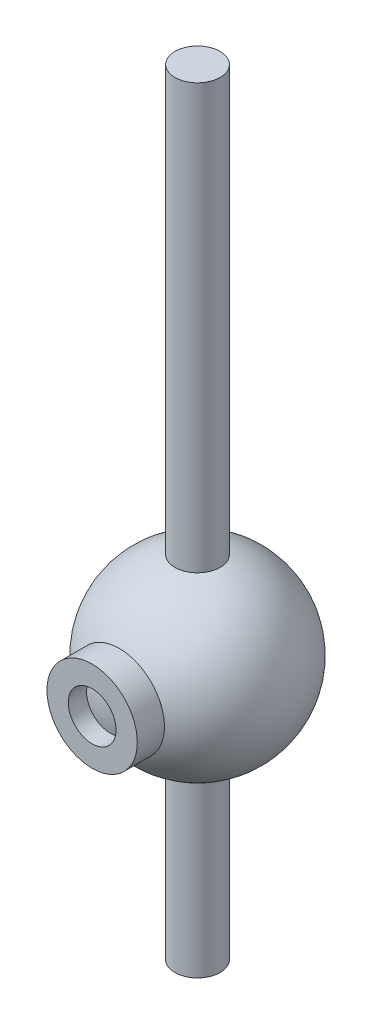
from build123d import *

# Parameters (mm, degrees)
BOSS_EXTRUDE1_START = 7
SKETCH1_R           = 6
SKETCH1_R_2         = 3.175
BOSS_EXTRUDE1_DEPTH = 7


with BuildPart() as part:
    # Sketch1 → Boss-Extrude1 (new body)
    with BuildSketch(Plane.XY.offset(BOSS_EXTRUDE1_START)):
        Circle(SKETCH1_R)
        Circle(SKETCH1_R_2, mode=Mode.SUBTRACT)
    extrude(amount=BOSS_EXTRUDE1_DEPTH)

    # Sketch2 → Revolve1 (revolve)
    with BuildSketch(Plane.XY):
        with BuildLine():
            Line((0, -35), (3, -35))
            Line((3, -35), (3, -11.618950039))
            ThreePointArc((3, -11.618950039), (12, 0), (3, 11.618950039))
            Line((3, 11.618950039), (3, 68))
            Line((3, 68), (0, 68))
            Line((0, 68), (0, -35))
        make_face()
    revolve(axis=Axis((0, -35, 0), (0, 1, 0)))


solid = part.part
